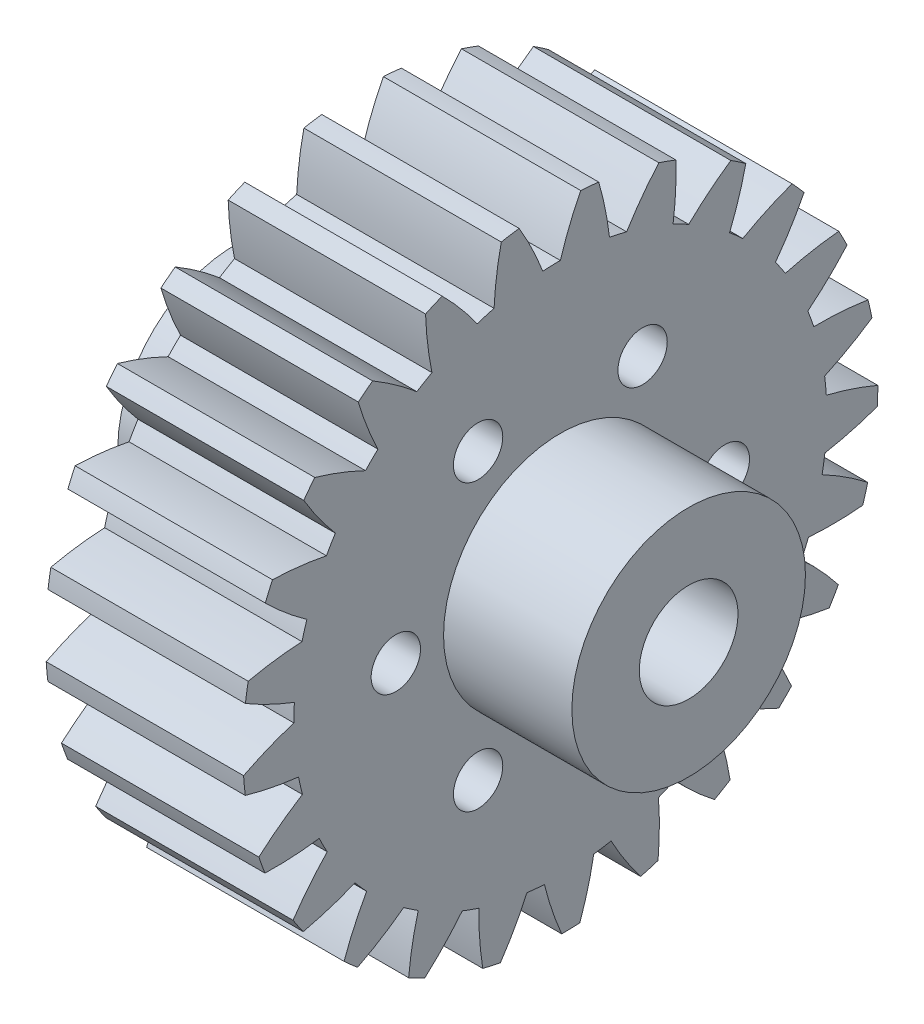
from build123d import *

# Parameters (mm, degrees)
SKETCH1_R                = 1.5
SKETCH1_R_2              = 3
BOSS_EXTRUDE1_DEPTH      = 12
BOSS_EXTRUDE2_DEPTH      = 7.8
BOSS_EXTRUDE2_DEPTH_BACK = 19.8
SKETCH2_R                = 7.1
SKETCH2_R_2              = 3


with BuildPart() as part:
    # Sketch1 → Boss-Extrude1 (new body)
    with BuildSketch(Plane(origin=(0, 0, 0), x_dir=(0, 0, -1), z_dir=(1, 0, 0))):
        with BuildLine():
            ThreePointArc((2.333948504, 19.158358082), (1.787037037, 19.217088714), (1.238674018, 19.260209933))
            ThreePointArc((1.238674018, 19.260209933), (0.554535379, 17.756334571), (0, 16.2))
            ThreePointArc((0, 16.2), (-0.5335039, 16.191212851), (-1.066429036, 16.164860937))
            ThreePointArc((-1.066429036, 16.164860937), (-1.72221346, 17.681315214), (-2.503866689, 19.136892423))
            ThreePointArc((-2.503866689, 19.136892423), (-3.048201641, 19.057766573), (-3.590060639, 18.963160723))
            ThreePointArc((-3.590060639, 18.963160723), (-3.878707211, 17.33639401), (-4.028776172, 15.69104721))
            ThreePointArc((-4.028776172, 15.69104721), (-4.543333791, 15.549859101), (-5.05296265, 15.391801989))
            ThreePointArc((-5.05296265, 15.391801989), (-6.065271243, 16.697527111), (-7.18435473, 17.912985433))
            ThreePointArc((-7.18435473, 17.912985433), (-7.6919106, 17.700974869), (-8.193218583, 17.474586383))
            ThreePointArc((-8.193218583, 17.474586383), (-8.068236361, 15.827144054), (-7.80440952, 14.196168217))
            ThreePointArc((-7.80440952, 14.196168217), (-8.26768931, 13.931450516), (-8.722000036, 13.651619515))
            ThreePointArc((-8.722000036, 13.651619515), (-10.027225727, 14.664571972), (-11.413423341, 15.563539688))
            ThreePointArc((-11.413423341, 15.563539688), (-11.852308527, 15.231965815), (-12.281566471, 14.888019513))
            ThreePointArc((-12.281566471, 14.888019513), (-11.750808548, 13.323416429), (-11.089663116, 11.809291764))
            ThreePointArc((-11.089663116, 11.809291764), (-11.472555504, 11.437677658), (-11.843002083, 11.053655579))
            ThreePointArc((-11.843002083, 11.053655579), (-13.35913274, 11.710187842), (-14.925344588, 12.236179507))
            ThreePointArc((-14.925344588, 12.236179507), (-15.26798232, 11.805876329), (-15.598218369, 11.365983623))
            ThreePointArc((-15.598218369, 11.365983623), (-14.695034218, 9.98252955), (-13.678112393, 8.680394079))
            ThreePointArc((-13.678112393, 8.680394079), (-13.956558843, 8.225233448), (-14.219864754, 7.761149811))
            ThreePointArc((-14.219864754, 7.761149811), (-15.851636313, 8.020009544), (-17.499451543, 8.139975165))
            ThreePointArc((-17.499451543, 8.139975165), (-17.724312631, 7.637980214), (-17.93477684, 7.129781181))
            ThreePointArc((-17.93477684, 7.129781181), (-16.715916843, 6.014403626), (-15.407115564, 5.006075309))
            ThreePointArc((-15.407115564, 5.006075309), (-15.56362026, 4.49596757), (-15.703241025, 3.980982457))
            ThreePointArc((-15.703241025, 3.980982457), (-17.348123278, 3.82590455), (-18.974003599, 3.532306247))
            ThreePointArc((-18.974003599, 3.532306247), (-19.066959195, 2.990161712), (-19.144427324, 2.445588366))
            ThreePointArc((-19.144427324, 2.445588366), (-17.686476936, 1.668370603), (-16.168033001, 1.017206416))
            ThreePointArc((-16.168033001, 1.017206416), (-16.192762178, 0.484203515), (-16.19992491, -0.049324666))
            ThreePointArc((-16.19992491, -0.049324666), (-17.754563855, -0.608596097), (-19.256349227, -1.297310463))
            ThreePointArc((-19.256349227, -1.297310463), (-19.211558589, -1.845539648), (-19.15116303, -2.392269761))
            ThreePointArc((-19.15116303, -2.392269761), (-17.545730637, -2.782492281), (-15.913053462, -3.035577296))
            ThreePointArc((-15.913053462, -3.035577296), (-15.804453295, -3.557984828), (-15.678707933, -4.076532539))
            ThreePointArc((-15.678707933, -4.076532539), (-17.045419888, -5.004856413), (-18.328747614, -6.045412386))
            ThreePointArc((-18.328747614, -6.045412386), (-18.149025101, -6.565278964), (-17.95456073, -7.07981278))
            ThreePointArc((-17.95456073, -7.07981278), (-16.302521553, -7.058520942), (-14.65819825, -6.897624523))
            ThreePointArc((-14.65819825, -6.897624523), (-14.423092487, -7.376611898), (-14.172340075, -7.84759688))
            ThreePointArc((-14.172340075, -7.84759688), (-15.265249501, -9.086643194), (-16.249483379, -10.413658815))
            ThreePointArc((-16.249483379, -10.413658815), (-15.946121619, -10.872497657), (-15.629807347, -11.322505125))
            ThreePointArc((-15.629807347, -11.322505125), (-14.034965084, -10.891036772), (-12.482314533, -10.326268634))
            ThreePointArc((-12.482314533, -10.326268634), (-12.135475734, -10.731739314), (-11.775471968, -11.125567847))
            ThreePointArc((-11.775471968, -11.125567847), (-12.525907347, -12.597482765), (-13.149204342, -14.127576762))
            ThreePointArc((-13.149204342, -14.127576762), (-12.74126467, -14.496557336), (-12.322975686, -14.853762831))
            ThreePointArc((-12.322975686, -14.853762831), (-10.885540141, -14.039228708), (-9.522121087, -13.106075309))
            ThreePointArc((-9.522121087, -13.106075309), (-9.085342409, -13.41255208), (-8.63870765, -13.70447847))
            ThreePointArc((-8.63870765, -13.70447847), (-8.999516367, -15.316776164), (-9.222712438, -16.953807103))
            ThreePointArc((-9.222712438, -16.953807103), (-8.735827203, -17.209745003), (-8.241846142, -17.45170399))
            ThreePointArc((-8.241846142, -17.45170399), (-7.052136677, -16.305284271), (-5.963617753, -15.062379071))
            ThreePointArc((-5.963617753, -15.062379071), (-5.464343607, -15.250604871), (-4.95914156, -15.422286309))
            ThreePointArc((-4.95914156, -15.422286309), (-4.907652675, -17.073660185), (-4.716723591, -18.714767393))
            ThreePointArc((-4.716723591, -18.714767393), (-4.181485584, -18.841581099), (-3.642851094, -18.953090405))
            ThreePointArc((-3.642851094, -18.953090405), (-2.77562153, -17.546818857), (-2.030398384, -16.072258161))
            ThreePointArc((-2.030398384, -16.072258161), (-1.5, -16.130406071), (-0.967974366, -16.17105518))
            ThreePointArc((-0.967974366, -16.17105518), (-0.507423117, -17.757743344), (0.085634345, -19.299810019))
            ThreePointArc((0.085634345, -19.299810019), (0.635594152, -19.28953136), (1.185037687, -19.263584445))
            ThreePointArc((1.185037687, -19.263584445), (1.675296126, -17.685822281), (2.030398384, -16.072258161))
            ThreePointArc((2.030398384, -16.072258161), (2.558594124, -15.996674533), (3.084014216, -15.903737181))
            ThreePointArc((3.084014216, -15.903737181), (3.924689702, -17.32604218), (4.88261156, -18.672174602))
            ThreePointArc((4.88261156, -18.672174602), (5.41273717, -18.525449423), (5.938466191, -18.363676628))
            ThreePointArc((5.938466191, -18.363676628), (6.020948765, -16.713560448), (5.963617753, -15.062379071))
            ThreePointArc((5.963617753, -15.062379071), (6.456422369, -14.857813103), (6.942222843, -14.637128885))
            ThreePointArc((6.942222843, -14.637128885), (8.110199833, -15.805682066), (9.372796334, -16.871297783))
            ThreePointArc((9.372796334, -16.871297783), (9.849778005, -16.597345367), (10.318759024, -16.309911472))
            ThreePointArc((10.318759024, -16.309911472), (9.98828305, -14.691124143), (9.522121087, -13.106075309))
            ThreePointArc((9.522121087, -13.106075309), (9.948569852, -12.785380632), (10.364226078, -12.450815949))
            ThreePointArc((10.364226078, -12.450815949), (11.786116281, -13.292192818), (13.274053844, -14.010335276))
            ThreePointArc((13.274053844, -14.010335276), (13.667921063, -13.626369062), (14.050686278, -13.231334594))
            ThreePointArc((14.050686278, -13.231334594), (13.328016776, -11.745590479), (12.482314533, -10.326268634))
            ThreePointArc((12.482314533, -10.326268634), (12.815612103, -9.909595675), (13.135006871, -9.482172457))
            ThreePointArc((13.135006871, -9.482172457), (14.721467697, -9.94350621), (16.341253732, -10.269051877))
            ThreePointArc((16.341253732, -10.269051877), (16.627258374, -9.799197873), (16.899757238, -9.321384302))
            ThreePointArc((16.899757238, -9.321384302), (15.830302192, -8.062038167), (14.65819825, -6.897624523))
            ThreePointArc((14.65819825, -6.897624523), (14.877402312, -6.411154376), (15.080466875, -5.917729196))
            ThreePointArc((15.080466875, -5.917729196), (16.731815155, -5.970032537), (18.381672549, -5.882526182))
            ThreePointArc((18.381672549, -5.882526182), (18.54184389, -5.356307044), (18.686954298, -4.825737152))
            ThreePointArc((18.686954298, -4.825737152), (17.3379115, -3.871918347), (15.913053462, -3.035577296))
            ThreePointArc((15.913053462, -3.035577296), (16.004390619, -2.50987667), (16.078365683, -1.981453246))
            ThreePointArc((16.078365683, -1.981453246), (17.690841132, -1.621439764), (19.267103277, -1.126379733))
            ThreePointArc((19.267103277, -1.126379733), (19.291377163, -0.576859743), (19.299981294, -0.02687119))
            ThreePointArc((19.299981294, -0.02687119), (17.756116065, 0.561488343), (16.168033001, 1.017206416))
            ThreePointArc((16.168033001, 1.017206416), (16.125764204, 1.549105818), (16.066001643, 2.079324699))
            ThreePointArc((16.066001643, 2.079324699), (17.538286499, 2.829034033), (18.941911047, 3.700541298))
            ThreePointArc((18.941911047, 3.700541298), (18.828762259, 4.238833776), (18.700319484, 4.773683188))
            ThreePointArc((18.700319484, 4.773683188), (17.058638555, 4.959614655), (15.407115564, 5.006075309))
            ThreePointArc((15.407115564, 5.006075309), (15.233896717, 5.510752291), (15.044151634, 6.009451025))
            ThreePointArc((15.044151634, 6.009451025), (16.283736823, 7.101749217), (17.426528882, 8.294943709))
            ThreePointArc((17.426528882, 8.294943709), (17.183066976, 8.78818578), (16.925647827, 9.274289495))
            ThreePointArc((16.925647827, 9.274289495), (15.289304048, 9.046110138), (13.678112393, 8.680394079))
            ThreePointArc((13.678112393, 8.680394079), (13.384827473, 9.12613793), (13.077022248, 9.561981443))
            ThreePointArc((13.077022248, 9.561981443), (14.006020076, 10.92823538), (14.816173817, 12.3681443))
            ThreePointArc((14.816173817, 12.3681443), (14.457696399, 12.785343751), (14.087475468, 13.192158085))
            ThreePointArc((14.087475468, 13.192158085), (12.559286337, 12.564205251), (11.089663116, 11.809291764))
            ThreePointArc((11.089663116, 11.809291764), (10.694740293, 12.168094759), (10.288215461, 12.5136974))
            ThreePointArc((10.288215461, 12.5136974), (10.848253576, 14.068060322), (11.274864061, 15.664208898))
            ThreePointArc((11.274864061, 15.664208898), (10.823895586, 15.979151552), (10.364135216, 16.281114864))
            ThreePointArc((10.364135216, 16.281114864), (9.040122475, 15.292845141), (7.80440952, 14.196168217))
            ThreePointArc((7.80440952, 14.196168217), (7.332663248, 14.445485443), (6.852962259, 14.679131727))
            ThreePointArc((6.852962259, 14.679131727), (7.008851408, 16.323937295), (7.02511313, 17.976033642))
            ThreePointArc((7.02511313, 17.976033642), (6.509989606, 18.168930495), (5.989578231, 18.347069319))
            ThreePointArc((5.989578231, 18.347069319), (4.952934471, 17.060579328), (4.028776172, 15.69104721))
            ThreePointArc((4.028776172, 15.69104721), (3.509848003, 15.81521315), (2.987112235, 15.922222222))
            ThreePointArc((2.987112235, 15.922222222), (2.729057328, 17.554121253), (2.333948504, 19.158358082))
        make_face()
        with Locations((10, 0)):
            Circle(SKETCH1_R, mode=Mode.SUBTRACT)
        with Locations((-5, -8.660254038)):
            Circle(SKETCH1_R, mode=Mode.SUBTRACT)
        with Locations((5, -8.660254038)):
            Circle(SKETCH1_R, mode=Mode.SUBTRACT)
        with Locations((-10, 0)):
            Circle(SKETCH1_R, mode=Mode.SUBTRACT)
        Circle(SKETCH1_R_2, mode=Mode.SUBTRACT)
        with Locations((-5, 8.660254038)):
            Circle(SKETCH1_R, mode=Mode.SUBTRACT)
        with Locations((5, 8.660254038)):
            Circle(SKETCH1_R, mode=Mode.SUBTRACT)
    extrude(amount=BOSS_EXTRUDE1_DEPTH)

    # Sketch2 → Boss-Extrude2 (add, two sides: drawn at the far end of the back side and taken through both)
    with BuildSketch(Plane(origin=(12, 0, 0), x_dir=(0, 0, -1), z_dir=(1, 0, 0)).offset(-BOSS_EXTRUDE2_DEPTH_BACK)):
        Circle(SKETCH2_R)
        Circle(SKETCH2_R_2, mode=Mode.SUBTRACT)
    extrude(amount=BOSS_EXTRUDE2_DEPTH + BOSS_EXTRUDE2_DEPTH_BACK)


solid = part.part
